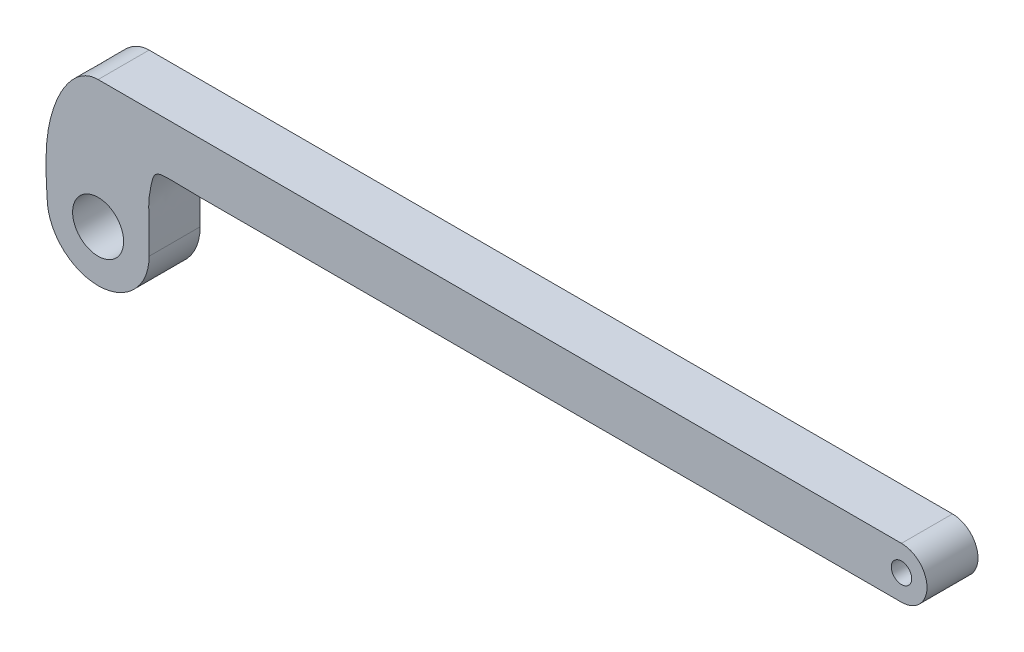
from build123d import *

# Parameters (mm, degrees)
SKETCH1_R           = 2
SKETCH1_R_2         = 5
BOSS_EXTRUDE1_DEPTH = 10


with BuildPart() as part:
    # Sketch1 → Boss-Extrude1 (new body)
    with BuildSketch(Plane(origin=(0, 0, 0), x_dir=(0, 1, 0), z_dir=(0, 0, 1))):
        with BuildLine():
            Line((25, 0), (25, -157.485))
            ThreePointArc((25, -157.485), (20, -162.485), (15, -157.485))
            Line((15, -157.485), (15, -20))
            add(Edge.make_bspline(
                [(0, -10), (6.790237035, -10), (8.986605454, -9.776088448), (16.124815875, -11.074928382), (15, -11.199503027), (15, -20)],
                knots=[0, 0, 0, 0, 0.182751564, 0.282751564, 1, 1, 1, 1], degree=3))
            ThreePointArc((0, -10), (-10, 0), (0, 10))
            add(Edge.make_bspline(
                [(0, 10), (0.681079819, 10), (14.239709664, 11.405780044), (25, 4.931387971), (25, 0)],
                knots=[0, 0, 0, 0, 0.356789172, 1, 1, 1, 1], degree=3))
        make_face()
        with Locations((20, -157.485)):
            Circle(SKETCH1_R, mode=Mode.SUBTRACT)
        Circle(SKETCH1_R_2, mode=Mode.SUBTRACT)
    extrude(amount=BOSS_EXTRUDE1_DEPTH)


solid = part.part
